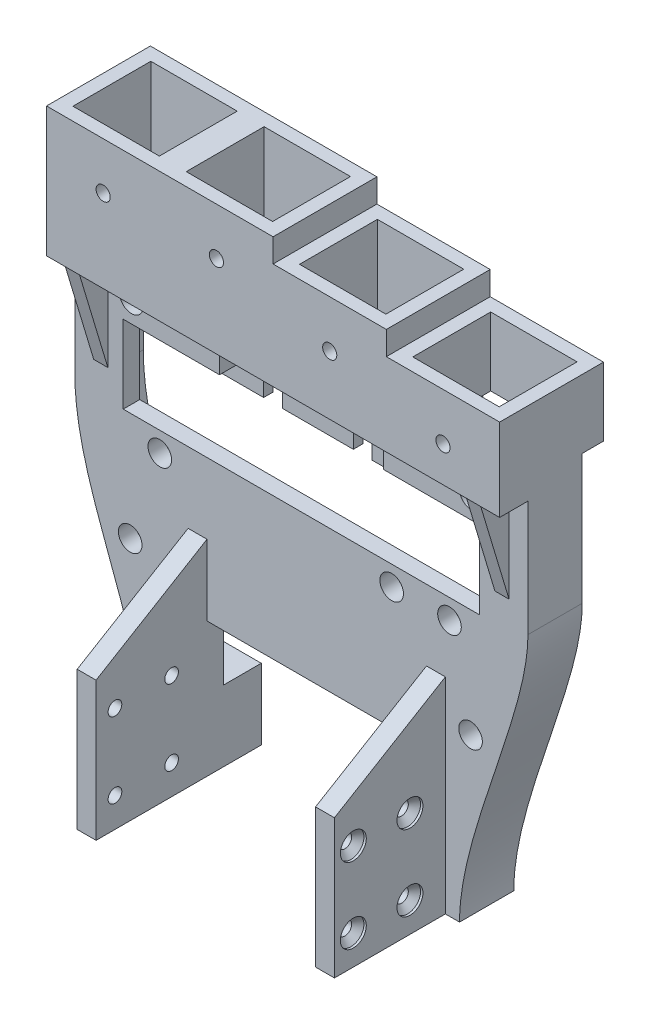
from build123d import *

# Parameters (mm, degrees)
BOSS_EXTRUDE1_DEPTH                            = 3.5
BOSS_EXTRUDE2_DEPTH                            = 6
BOSS_EXTRUDE3_DEPTH                            = 6
BOSS_EXTRUDE3_DEPTH_BACK                       = 16
SKETCH4_W                                      = 18.3
SKETCH4_H                                      = 16.5
CUT_EXTRUDE1_DEPTH                             = 24.5
SKETCH5_W                                      = 96
SKETCH5_H                                      = 3
BOSS_EXTRUDE4_DEPTH                            = 6
SKETCH6_W                                      = 75.5
SKETCH6_H                                      = 16.5
CUT_EXTRUDE2_DEPTH                             = 149.377895928
SKETCH7_W                                      = 10
SKETCH7_H                                      = 15.5
SKETCH7_W_2                                    = 20
BOSS_EXTRUDE5_DEPTH                            = 2
SKETCH9_R                                      = 1.25
CUT_EXTRUDE3_DEPTH                             = 149.377895928
BOSS_EXTRUDE7_START                            = -7
BOSS_EXTRUDE7_DEPTH                            = 3
BOSS_EXTRUDE8_START                            = -92
BOSS_EXTRUDE8_DEPTH                            = 3
SKETCH19_W                                     = 46.5
SKETCH19_H                                     = 28.5
CUT_EXTRUDE8_DEPTH                             = 149.041379351
SKETCH20_W                                     = 4
SKETCH20_H                                     = 28.5
BOSS_EXTRUDE10_DEPTH                           = 23.5
SKETCH21_R                                     = 1
CUT_EXTRUDE9_DEPTH                             = 140.410365468
CUT_EXTRUDE10_DEPTH                            = 150.372855633
CHAMFER2_SIZE                                  = 15
CHAMFER2_SIZE_2                                = 25
SKETCH23_W                                     = 10
SKETCH23_H                                     = 8.5
SKETCH23_W_2                                   = 20
BOSS_EXTRUDE11_DEPTH                           = 6
BOSS_EXTRUDE12_REACH                           = 151.963
BOSS_EXTRUDE13_DEPTH                           = 8
SKETCH28_R                                     = 2
CUT_EXTRUDE11_DEPTH                            = 5
SKETCH29_R                                     = 1.5
CUT_EXTRUDE12_DEPTH                            = 2.75
SKETCH31_W                                     = 76
SKETCH31_H                                     = 7
BOSS_EXTRUDE14_DEPTH                           = 2
SKETCH30_W                                     = 4
SKETCH30_H                                     = 7
CUT_EXTRUDE13_DEPTH                            = 2
SKETCH32_W                                     = 4
SKETCH32_H                                     = 8.5
BOSS_EXTRUDE15_DEPTH                           = 8
SKETCH33_R                                     = 1
CUT_EXTRUDE14_DEPTH                            = 152.608047343
CUT_EXTRUDE15_DEPTH                            = 8
FILLET1_START                                  = -8
FILLET1_DEPTH                                  = 8
SKETCH35_R                                     = 2.5
CUT_EXTRUDE16_DEPTH                            = 150.372855697
SKETCH36_W                                     = 34.7
SKETCH36_H                                     = 5.7
CUT_EXTRUDE17_DEPTH                            = 3.5
CSK_FOR_M2_5_COUNTERSUNK_FLAT_HEAD_S_2_COUNT   = 2
CSK_FOR_M2_5_COUNTERSUNK_FLAT_HEAD_S_2_PITCH   = 16
CSK_FOR_M2_5_COUNTERSUNK_FLAT_HEAD_S_3_COUNT   = 2
CSK_FOR_M2_5_COUNTERSUNK_FLAT_HEAD_S_3_PITCH   = 20
CSK_FOR_M2_5_COUNTERSUNK_FLAT_HEAD_S_4_COUNT   = 2
CSK_FOR_M2_5_COUNTERSUNK_FLAT_HEAD_S_4_PITCH   = 12
CSK_FOR_M2_5_COUNTERSUNK_FLAT_HEAD_S_5_A_COUNT = 2
CSK_FOR_M2_5_COUNTERSUNK_FLAT_HEAD_S_5_A_PITCH = 12
CSK_FOR_M2_5_COUNTERSUNK_FLAT_HEAD_S_6_COUNT   = 2
CSK_FOR_M2_5_COUNTERSUNK_FLAT_HEAD_S_6_PITCH   = 20
CSK_FOR_M2_5_COUNTERSUNK_FLAT_HEAD_S_7_COUNT   = 2
CSK_FOR_M2_5_COUNTERSUNK_FLAT_HEAD_S_7_PITCH   = 16


with BuildPart() as part:
    # Sketch1 → Boss-Extrude1 (new body)
    with BuildSketch(Plane.XY):
        Polygon((0, 0), (0, 112), (48, 112), (48, 107), (72, 107), (72, 102), (96, 102), (96, 0), align=None)
    extrude(amount=BOSS_EXTRUDE1_DEPTH)

    # Sketch3 → Boss-Extrude2 (add)
    with BuildSketch(Plane.XY.offset(3.5)):
        Polygon((0, 112), (48, 112), (48, 107), (72, 107), (72, 102), (96, 102), (96, 87.5), (0, 87.5), align=None)
    extrude(amount=BOSS_EXTRUDE2_DEPTH)

    # Sketch3<2> → Boss-Extrude3 (add, two sides: drawn at the far end of the back side and taken through both)
    with BuildSketch(Plane.XY.offset(3.5).offset(-BOSS_EXTRUDE3_DEPTH_BACK)):
        Polygon((0, 112), (48, 112), (48, 107), (72, 107), (72, 102), (96, 102), (96, 87.5), (0, 87.5), align=None)
    extrude(amount=BOSS_EXTRUDE3_DEPTH + BOSS_EXTRUDE3_DEPTH_BACK)

    # Sketch4 → Cut-Extrude1 (cut)
    with BuildSketch(Plane(origin=(0, 112, 0), x_dir=(1, 0, 0), z_dir=(0, 1, 0))):
        with Locations((12, 1.5)):
            Rectangle(SKETCH4_W, SKETCH4_H)
        with Locations((36, 1.5)):
            Rectangle(SKETCH4_W, SKETCH4_H)
        with Locations((60, 1.5)):
            Rectangle(SKETCH4_W, SKETCH4_H)
        with Locations((84, 1.5)):
            Rectangle(SKETCH4_W, SKETCH4_H)
    extrude(amount=-CUT_EXTRUDE1_DEPTH, mode=Mode.SUBTRACT)

    # Sketch5 → Boss-Extrude4 (add)
    with BuildSketch(Plane.XY.offset(3.5)):
        with Locations((48, 86)):
            Rectangle(SKETCH5_W, SKETCH5_H)
    extrude(amount=BOSS_EXTRUDE4_DEPTH)

    # Sketch6 → Cut-Extrude2 (cut, through all)
    with BuildSketch(Plane.XY.offset(3.5)):
        with Locations((48, 66.75)):
            Rectangle(SKETCH6_W, SKETCH6_H)
    extrude(amount=-CUT_EXTRUDE2_DEPTH, mode=Mode.SUBTRACT)

    # Sketch7 → Boss-Extrude5 (add)
    with BuildSketch(Plane(origin=(0, 0, 0), x_dir=(-1, 0, 0), z_dir=(0, 0, -1))):
        with Locations((-91, 79.75)):
            Rectangle(SKETCH7_W, SKETCH7_H)
        with Locations((-72, 79.75)):
            Rectangle(SKETCH7_W_2, SKETCH7_H)
        with Locations((-48, 79.75)):
            Rectangle(SKETCH7_W_2, SKETCH7_H)
        with Locations((-24, 79.75)):
            Rectangle(SKETCH7_W_2, SKETCH7_H)
        with Locations((-5, 79.75)):
            Rectangle(SKETCH7_W, SKETCH7_H)
    extrude(amount=BOSS_EXTRUDE5_DEPTH)

    # Sketch9 → Cut-Extrude3 (cut, through all)
    with BuildSketch(Plane.XY.offset(3.5)):
        with Locations((84, 79.4)):
            Circle(SKETCH9_R)
        with Locations((79.375, 54.3)):
            Circle(SKETCH9_R)
        with Locations((67.125, 54.3)):
            Circle(SKETCH9_R)
        with Locations((18, 54.3)):
            Circle(SKETCH9_R)
        with Locations((12, 79.4)):
            Circle(SKETCH9_R)
    extrude(amount=-CUT_EXTRUDE3_DEPTH, mode=Mode.SUBTRACT)

    # Sketch13 → Boss-Extrude7 (add)
    with BuildSketch(Plane(origin=(96, 0, 0), x_dir=(0, 0, -1), z_dir=(1, 0, 0)).offset(BOSS_EXTRUDE7_START)):
        Polygon((-3.5, 64.5), (-3.5, 84.5), (-9.5, 84.5), align=None)
    extrude(amount=BOSS_EXTRUDE7_DEPTH)

    # Sketch13<2> → Boss-Extrude8 (add)
    with BuildSketch(Plane(origin=(96, 0, 0), x_dir=(0, 0, -1), z_dir=(1, 0, 0)).offset(BOSS_EXTRUDE8_START)):
        Polygon((-3.5, 64.5), (-3.5, 84.5), (-9.5, 84.5), align=None)
    extrude(amount=BOSS_EXTRUDE8_DEPTH)

    # Sketch19 → Cut-Extrude8 (cut, through all)
    with BuildSketch(Plane(origin=(0, 0, 0), x_dir=(-1, 0, 0), z_dir=(0, 0, -1))):
        with Locations((-51.25, 14.25)):
            Rectangle(SKETCH19_W, SKETCH19_H)
    extrude(amount=-CUT_EXTRUDE8_DEPTH, mode=Mode.SUBTRACT)

    # Sketch20 → Boss-Extrude10 (add)
    with BuildSketch(Plane.XY.offset(3.5)):
        with Locations((76.5, 14.25)):
            Rectangle(SKETCH20_W, SKETCH20_H)
        with Locations((26, 14.25)):
            Rectangle(SKETCH20_W, SKETCH20_H)
    extrude(amount=BOSS_EXTRUDE10_DEPTH)

    # Sketch21 → Cut-Extrude9 (cut, through all)
    with BuildSketch(Plane(origin=(78.5, 0, 0), x_dir=(0, 0, -1), z_dir=(1, 0, 0))):
        with Locations(Location((-23, 6.25, 0), (0, 0, 90))):
            Circle(SKETCH21_R)
        with Locations(Location((-23, 22.25, 0), (0, 0, 90))):
            Circle(SKETCH21_R)
        with Locations(Location((-11, 22.25, 0), (0, 0, 90))):
            Circle(SKETCH21_R)
        with Locations(Location((-11, 6.25, 0), (0, 0, 90))):
            Circle(SKETCH21_R)
    extrude(amount=-CUT_EXTRUDE9_DEPTH, mode=Mode.SUBTRACT)

    # Sketch22 → Cut-Extrude10 (cut, through all)
    with BuildSketch(Plane.XY.offset(3.5)):
        with BuildLine():
            Line((0, 60), (0, 0))
            Line((0, 0), (14.5, 0))
            add(Edge.make_bspline(
                [(0, 60), (0, 38.91249655), (14.5, 21.1060871), (14.5, 0)],
                knots=[0, 0, 0, 0, 1, 1, 1, 1], degree=3))
        make_face()
        with BuildLine():
            Line((81.5, 0), (96, 0))
            Line((96, 0), (96, 60))
            add(Edge.make_bspline(
                [(96, 60), (96, 44.479329369), (81.5, 17.438131956), (81.5, 0)],
                knots=[0, 0, 0, 0, 1, 1, 1, 1], degree=3))
        make_face()
    extrude(amount=-CUT_EXTRUDE10_DEPTH, mode=Mode.SUBTRACT)

    # Chamfer2
    # the kernel refuses this chamfer: 25, 15 mm, written as the material it adds along each edge
    with BuildSketch(Plane(origin=(92.65652743, 28.5, 3.5), x_dir=(0, 1, 0), z_dir=(-1, 0, 0))) as chamfer2_piece_1_section:
        Polygon((CHAMFER2_SIZE, 0), (0, -CHAMFER2_SIZE_2), (0, 0), align=None)
    chamfer2_piece_1 = extrude(amount=133.31305486, mode=Mode.PRIVATE)
    chamfer2_piece_1 = split(chamfer2_piece_1, bisect_by=Plane(origin=(74.5, 28.5, 3.5), z_dir=(1, 0, 0)), keep=Keep.TOP, mode=Mode.PRIVATE)
    chamfer2_piece_1 = split(chamfer2_piece_1, bisect_by=Plane(origin=(78.5, 28.5, 3.5), z_dir=(-1, 0, 0)), keep=Keep.TOP, mode=Mode.PRIVATE)
    chamfer2_piece_1 = split(chamfer2_piece_1, bisect_by=Plane(origin=(92.65652743, 28.5, 27), z_dir=(0, 0, -1)), keep=Keep.TOP, mode=Mode.PRIVATE)
    add(chamfer2_piece_1)
    with BuildSketch(Plane(origin=(28, 28.5, 3.5), x_dir=(0, 1, 0), z_dir=(-1, 0, 0))) as chamfer2_piece_2_section:
        Polygon((CHAMFER2_SIZE, 0), (0, -CHAMFER2_SIZE_2), (0, 0), align=None)
    chamfer2_piece_2 = extrude(amount=4, mode=Mode.PRIVATE)
    chamfer2_piece_2 = split(chamfer2_piece_2, bisect_by=Plane(origin=(28, 28.5, 27), z_dir=(0, 0, -1)), keep=Keep.TOP, mode=Mode.PRIVATE)
    add(chamfer2_piece_2)
    with BuildSketch(Plane(origin=(9.84347257, 28.5, 3.5), x_dir=(0, 1, 0), z_dir=(1, 0, 0))) as chamfer2_piece_3_section:
        Polygon((CHAMFER2_SIZE, 0), (0, CHAMFER2_SIZE_2), (0, 0), align=None)
    chamfer2_piece_3 = extrude(amount=133.31305486, mode=Mode.PRIVATE)
    chamfer2_piece_3 = split(chamfer2_piece_3, bisect_by=Plane(origin=(28, 28.5, 3.5), z_dir=(-1, 0, 0)), keep=Keep.TOP, mode=Mode.PRIVATE)
    chamfer2_piece_3 = split(chamfer2_piece_3, bisect_by=Plane(origin=(24, 28.5, 3.5), z_dir=(1, 0, 0)), keep=Keep.TOP, mode=Mode.PRIVATE)
    chamfer2_piece_3 = split(chamfer2_piece_3, bisect_by=Plane(origin=(9.84347257, 28.5, 27), z_dir=(0, 0, -1)), keep=Keep.TOP, mode=Mode.PRIVATE)
    add(chamfer2_piece_3)
    with BuildSketch(Plane(origin=(74.5, 28.5, 3.5), x_dir=(0, 1, 0), z_dir=(1, 0, 0))) as chamfer2_piece_4_section:
        Polygon((CHAMFER2_SIZE, 0), (0, CHAMFER2_SIZE_2), (0, 0), align=None)
    chamfer2_piece_4 = extrude(amount=4, mode=Mode.PRIVATE)
    chamfer2_piece_4 = split(chamfer2_piece_4, bisect_by=Plane(origin=(74.5, 28.5, 27), z_dir=(0, 0, -1)), keep=Keep.TOP, mode=Mode.PRIVATE)
    add(chamfer2_piece_4)

    # Sketch23 → Boss-Extrude11 (add)
    with BuildSketch(Plane(origin=(0, 0, -2), x_dir=(-1, 0, 0), z_dir=(0, 0, -1))):
        with Locations((-91, 83.25)):
            Rectangle(SKETCH23_W, SKETCH23_H)
        with Locations((-72, 83.25)):
            Rectangle(SKETCH23_W_2, SKETCH23_H)
        with Locations((-48, 83.25)):
            Rectangle(SKETCH23_W_2, SKETCH23_H)
        with Locations((-24, 83.25)):
            Rectangle(SKETCH23_W_2, SKETCH23_H)
        with Locations((-5, 83.25)):
            Rectangle(SKETCH23_W, SKETCH23_H)
    extrude(amount=BOSS_EXTRUDE11_DEPTH)

    # Boss-Extrude12: up to this face of the body (flat: up to its plane)
    boss_extrude12_end = Plane(part.part.faces().sort_by_distance((91, 83.25, -8))[0])
    # Sketch25 → Boss-Extrude12 (add, up to the picked face)
    with BuildSketch(Plane(origin=(0, 0, 0), x_dir=(-1, 0, 0), z_dir=(0, 0, -1)), mode=Mode.PRIVATE) as boss_extrude12_sk1:
        with BuildLine():
            Line((-96, 72), (-96, 60))
            add(Edge.make_bspline(
                [(-96, 60), (-96, 44.479329369), (-81.5, 17.438131956), (-81.5, 0)],
                knots=[0, 0, 0, 0, 1, 1, 1, 1], degree=3))
            Line((-81.5, 0), (-78.5, 0))
            add(Edge.make_bspline(
                [(-93, 60), (-93, 59.557816417), (-92.975040614, 58.695571703), (-92.827111841, 56.79827861), (-92.464493125, 54.245611233), (-91.775146218, 50.906511623), (-90.567249245, 46.161807553), (-88.616785555, 39.780457105), (-85.908273471, 31.695495019), (-83.173013091, 23.441525704), (-81.155530615, 16.62102995), (-79.871757105, 11.305292179), (-79.119035762, 7.410326951), (-78.706235407, 4.261007874), (-78.530993655, 1.79992434), (-78.5, 0.602960826), (-78.5, 0)],
                knots=[0, 0, 0, 0, 0.03125, 0.0625, 0.125, 0.1875, 0.25, 0.375, 0.5, 0.625, 0.75, 0.8125, 0.875, 0.9375, 0.96875, 1, 1, 1, 1], degree=3))
            Line((-93, 60), (-93, 72))
            Line((-93, 72), (-93, 79))
            Line((-93, 79), (-96, 79))
            Line((-96, 79), (-96, 72))
        make_face()
    boss_extrude12_tool1 = split(extrude(boss_extrude12_sk1.sketch, amount=BOSS_EXTRUDE12_REACH, mode=Mode.PRIVATE), bisect_by=boss_extrude12_end, keep=Keep.BOTH, mode=Mode.PRIVATE)
    # Sketch25 → Boss-Extrude12 (add, up to the picked face)
    with BuildSketch(Plane(origin=(0, 0, 0), x_dir=(-1, 0, 0), z_dir=(0, 0, -1)), mode=Mode.PRIVATE) as boss_extrude12_sk2:
        with BuildLine():
            Line((0, 60), (0, 72))
            Line((0, 72), (0, 79))
            Line((0, 79), (-3, 79))
            Line((-3, 79), (-3, 72))
            Line((-3, 72), (-3, 60))
            add(Edge.make_bspline(
                [(-17.5, 0), (-17.5, 1.389708781), (-17.379306316, 4.18867325), (-16.720428739, 9.601539546), (-15.238805861, 16.15624072), (-12.795783031, 23.718268712), (-10.053136414, 31.075787181), (-7.358206107, 38.306889553), (-5.043365619, 45.489457561), (-3.423025008, 52.669495341), (-3, 57.557046138), (-3, 60)],
                knots=[0, 0, 0, 0, 0.0625, 0.125, 0.25, 0.375, 0.5, 0.625, 0.75, 0.875, 1, 1, 1, 1], degree=3))
            Line((-17.5, 0), (-14.5, 0))
            add(Edge.make_bspline(
                [(-14.5, 0), (-14.5, 21.1060871), (0, 38.91249655), (0, 60)],
                knots=[0, 0, 0, 0, 1, 1, 1, 1], degree=3))
        make_face()
    boss_extrude12_tool2 = split(extrude(boss_extrude12_sk2.sketch, amount=BOSS_EXTRUDE12_REACH, mode=Mode.PRIVATE), bisect_by=boss_extrude12_end, keep=Keep.BOTH, mode=Mode.PRIVATE)
    add(boss_extrude12_tool1.solids().sort_by(Axis((88.814086, 39.296604, 0), (0, 0, -1)))[0])
    add(boss_extrude12_tool2.solids().sort_by(Axis((0.809151, 66, 0), (0, 0, -1)))[0])

    # Sketch27 → Boss-Extrude13 (add)
    with BuildSketch(Plane(origin=(0, 0, 0), x_dir=(-1, 0, 0), z_dir=(0, 0, -1))):
        Polygon((-81.5, 0), (-74.5, 0), (-74.5, 15), (-80.78355962, 15), align=None)
        Polygon((-28, 0), (-14.5, 0), (-15.422624823, 15), (-28, 15), align=None)
    extrude(amount=BOSS_EXTRUDE13_DEPTH)

    # Sketch28 → Cut-Extrude11 (cut)
    with BuildSketch(Plane(origin=(0, 0, -8), x_dir=(-1, 0, 0), z_dir=(0, 0, -1))):
        with Locations((-91, 83.25)):
            Circle(SKETCH28_R)
        with Locations((-72, 83.25)):
            Circle(SKETCH28_R)
        with Locations((-48, 83.25)):
            Circle(SKETCH28_R)
        with Locations((-24, 83.25)):
            Circle(SKETCH28_R)
        with Locations((-5, 83.25)):
            Circle(SKETCH28_R)
        with Locations((-21.25, 7.5)):
            Circle(SKETCH28_R)
        with Locations((-78, 7.5)):
            Circle(SKETCH28_R)
    extrude(amount=-CUT_EXTRUDE11_DEPTH, mode=Mode.SUBTRACT)

    # Sketch29 → Cut-Extrude12 (cut)
    with BuildSketch(Plane.XY.offset(9.5)):
        with Locations((84, 92)):
            Circle(SKETCH29_R)
        with Locations((60, 97)):
            Circle(SKETCH29_R)
        with Locations((12, 102)):
            Circle(SKETCH29_R)
        with Locations((36, 102)):
            Circle(SKETCH29_R)
    extrude(amount=-CUT_EXTRUDE12_DEPTH, mode=Mode.SUBTRACT)

    # Sketch31 → Boss-Extrude14 (add)
    with BuildSketch(Plane(origin=(0, 0, -2), x_dir=(-1, 0, 0), z_dir=(0, 0, -1))):
        with Locations((-48, 75.5)):
            Rectangle(SKETCH31_W, SKETCH31_H)
    extrude(amount=-BOSS_EXTRUDE14_DEPTH)

    # Sketch30 → Cut-Extrude13 (cut)
    with BuildSketch(Plane(origin=(0, 0, -2), x_dir=(-1, 0, 0), z_dir=(0, 0, -1))):
        with Locations((-76.5, 75.5)):
            Rectangle(SKETCH30_W, SKETCH30_H)
        with Locations((-57.5, 75.5)):
            Rectangle(SKETCH30_W, SKETCH30_H)
        with Locations((-38.5, 75.5)):
            Rectangle(SKETCH30_W, SKETCH30_H)
        with Locations((-19.5, 75.5)):
            Rectangle(SKETCH30_W, SKETCH30_H)
    extrude(amount=-CUT_EXTRUDE13_DEPTH, mode=Mode.SUBTRACT)

    # Sketch32 → Boss-Extrude15 (add)
    with BuildSketch(Plane(origin=(0, 0, 0), x_dir=(-1, 0, 0), z_dir=(0, 0, -1))):
        with Locations((-84, 83.25)):
            Rectangle(SKETCH32_W, SKETCH32_H)
        with Locations((-60, 83.25)):
            Rectangle(SKETCH32_W, SKETCH32_H)
        with Locations((-36, 83.25)):
            Rectangle(SKETCH32_W, SKETCH32_H)
        with Locations((-12, 83.25)):
            Rectangle(SKETCH32_W, SKETCH32_H)
    extrude(amount=BOSS_EXTRUDE15_DEPTH)

    # Sketch33 → Cut-Extrude14 (cut, through all)
    with BuildSketch(Plane(origin=(0, 0, -8), x_dir=(-1, 0, 0), z_dir=(0, 0, -1))):
        with Locations((-78.5, 83)):
            Circle(SKETCH33_R)
        with Locations((-59.5, 83)):
            Circle(SKETCH33_R)
        with Locations((-36.5, 83)):
            Circle(SKETCH33_R)
        with Locations((-17.5, 83)):
            Circle(SKETCH33_R)
    extrude(amount=-CUT_EXTRUDE14_DEPTH, mode=Mode.SUBTRACT)

    # Sketch34 → Cut-Extrude15 (cut)
    with BuildSketch(Plane(origin=(0, 0, -8), x_dir=(-1, 0, 0), z_dir=(0, 0, -1))):
        with BuildLine():
            Line((-77.5, 79), (-75.5, 79))
            Line((-75.5, 79), (-75.5, 83))
            ThreePointArc((-75.5, 83), (-76.090385292, 84.787108547), (-77.629171307, 85.870828693))
            Line((-77.629171307, 85.870828693), (-83, 87.5))
            Line((-83, 87.5), (-85, 87.5))
            Line((-85, 87.5), (-78.039362063, 83.887588131))
            ThreePointArc((-78.039362063, 83.887588131), (-77.645412984, 83.519308224), (-77.5, 83))
            Line((-77.5, 83), (-77.5, 79))
        make_face()
        with BuildLine():
            Line((-58.5, 83), (-58.5, 79))
            Line((-58.5, 79), (-56.5, 79))
            Line((-56.5, 79), (-56.5, 83))
            ThreePointArc((-56.5, 83), (-56.527487495, 83.405178241), (-56.609446271, 83.802931591))
            Line((-56.609446271, 83.802931591), (-58.886409718, 92))
            Line((-58.886409718, 92), (-60.962136573, 92))
            Line((-60.962136573, 92), (-58.53648209, 83.267643864))
            ThreePointArc((-58.53648209, 83.267643864), (-58.509162498, 83.135059414), (-58.5, 83))
        make_face()
        with BuildLine():
            Line((-37.5, 83), (-37.5, 79))
            Line((-37.5, 79), (-39.5, 79))
            Line((-39.5, 79), (-39.5, 83))
            ThreePointArc((-39.5, 83), (-39.488297858, 83.264718549), (-39.453282727, 83.527371915))
            Line((-39.453282727, 83.527371915), (-37.047456283, 97))
            Line((-37.047456283, 97), (-35.015818761, 97))
            Line((-35.015818761, 97), (-37.484427576, 83.175790638))
            ThreePointArc((-37.484427576, 83.175790638), (-37.496099286, 83.088239516), (-37.5, 83))
        make_face()
        with BuildLine():
            Line((-18.5, 83), (-18.5, 79))
            Line((-18.5, 79), (-20.5, 79))
            Line((-20.5, 79), (-20.5, 83))
            ThreePointArc((-20.5, 83), (-20.409752544, 83.7303014), (-20.14443991, 84.416664238))
            Line((-20.14443991, 84.416664238), (-13.40336718, 97))
            Line((-13.40336718, 97), (-11.134455727, 97))
            Line((-11.134455727, 97), (-18.38147997, 83.472221413))
            ThreePointArc((-18.38147997, 83.472221413), (-18.469917515, 83.2434338), (-18.5, 83))
        make_face()
    extrude(amount=-CUT_EXTRUDE15_DEPTH, mode=Mode.SUBTRACT)

    # Fillet1: read off the stored shape, not the designer's step
    # Fillet1 outline → Fillet1 (cut)
    with BuildSketch(Plane.XY.offset(FILLET1_START)):
        with BuildLine():
            Line((83, 87.5), (74.85, 87.5))
            ThreePointArc((74.85, 87.5), (75.689930119, 85.76161962), (75.61776777, 83.832308461))
            ThreePointArc((75.61776777, 83.832308461), (76.364523998, 85.107069586), (77.629171307, 85.870828693))
            Line((77.629171307, 85.870828693), (83, 87.5))
        make_face()
        with BuildLine():
            Line((85.976140779, 87.5), (85, 87.5))
            Line((85, 87.5), (84.13358903, 87.050352525))
            ThreePointArc((84.13358903, 87.050352525), (85.027829148, 87.385962564), (85.976140779, 87.5))
        make_face()
        with BuildLine():
            Line((16.223741441, 87.5), (13.828775677, 87.5))
            ThreePointArc((13.828775677, 87.5), (15.883581921, 86.93187577), (17.354695557, 85.38888565))
            Line((17.354695557, 85.38888565), (16.223741441, 87.5))
        make_face()
        with BuildLine():
            Line((21.15, 87.5), (18.492652894, 87.5))
            Line((18.492652894, 87.5), (20.14443991, 84.416664238))
            ThreePointArc((20.14443991, 84.416664238), (20.27873967, 84.130754548), (20.38223223, 83.832308461))
            ThreePointArc((20.38223223, 83.832308461), (20.310069881, 85.76161962), (21.15, 87.5))
        make_face()
        with BuildLine():
            Line((57.636409718, 87.5), (52.517879978, 87.5))
            ThreePointArc((52.517879978, 87.5), (55.445580197, 86.225540575), (56.507662848, 83.214285714))
            ThreePointArc((56.507662848, 83.214285714), (56.543866161, 83.51114844), (56.609446271, 83.802931591))
            Line((56.609446271, 83.802931591), (57.636409718, 87.5))
        make_face()
        with BuildLine():
            ThreePointArc((39.453282727, 83.527371915), (39.476928732, 83.371342593), (39.492337152, 83.214285714))
            ThreePointArc((39.492337152, 83.214285714), (40.554419803, 86.225540575), (43.482120022, 87.5))
            Line((43.482120022, 87.5), (38.743884854, 87.5))
            Line((38.743884854, 87.5), (39.453282727, 83.527371915))
        make_face()
        with BuildLine():
            Line((37.300968305, 84.203162554), (36.712247332, 87.5))
            Line((36.712247332, 87.5), (33.363258003, 87.5))
            ThreePointArc((33.363258003, 87.5), (35.931073201, 86.566973281), (37.300968305, 84.203162554))
        make_face()
    extrude(amount=FILLET1_DEPTH, mode=Mode.SUBTRACT)

    # Sketch35 → Cut-Extrude16 (cut, through all)
    with BuildSketch(Plane.XY.offset(3.5)):
        with Locations((12, 79.4)):
            Circle(SKETCH35_R)
        with Locations((84, 79.4)):
            Circle(SKETCH35_R)
        with Locations((79.375, 54.3)):
            Circle(SKETCH35_R)
        with Locations((67.125, 54.3)):
            Circle(SKETCH35_R)
        with Locations((18, 54.3)):
            Circle(SKETCH35_R)
        with Locations((83.839330344, 35.5)):
            Circle(SKETCH35_R)
        with Locations((11.728705136, 35.5)):
            Circle(SKETCH35_R)
    extrude(amount=-CUT_EXTRUDE16_DEPTH, mode=Mode.SUBTRACT)

    # Sketch36 → Cut-Extrude17 (cut)
    with BuildSketch(Plane.XY.offset(3.5)):
        with Locations((48, 77.85)):
            Rectangle(SKETCH36_W, SKETCH36_H)
    extrude(amount=-CUT_EXTRUDE17_DEPTH, mode=Mode.SUBTRACT)

    # Sketch39 → CSK for M2.5 Countersunk Flat Head Screw (revolve, cut)
    with BuildSketch(Plane(origin=(78.5, 6.25, 11), x_dir=(0, 0, -1), z_dir=(0, 1, 0))):
        Polygon((0, 0), (0, 78.5), (1.45, 78.5), (1.45, 1.8), (2.75, 0.5), (2.75, 0), align=None)
    csk_for_m2_5_countersunk_flat_head_screw = revolve(axis=Axis((84.85, 6.25, 11), (-1, 0, 0)), mode=Mode.SUBTRACT)

    # CSK for M2.5 Countersunk Flat Head S 2: CSK for M2.5 Countersunk Flat Head Screw ×2
    with Locations(*[(0, i * CSK_FOR_M2_5_COUNTERSUNK_FLAT_HEAD_S_2_PITCH, 0) for i in range(1, CSK_FOR_M2_5_COUNTERSUNK_FLAT_HEAD_S_2_COUNT)]):
        add(csk_for_m2_5_countersunk_flat_head_screw, mode=Mode.SUBTRACT)

    # CSK for M2.5 Countersunk Flat Head S 3: CSK for M2.5 Countersunk Flat Head Screw ×2
    with Locations(*[Vector(0, 0.8, 0.6000000000000001) * (i * CSK_FOR_M2_5_COUNTERSUNK_FLAT_HEAD_S_3_PITCH) for i in range(1, CSK_FOR_M2_5_COUNTERSUNK_FLAT_HEAD_S_3_COUNT)]):
        add(csk_for_m2_5_countersunk_flat_head_screw, mode=Mode.SUBTRACT)

    # CSK for M2.5 Countersunk Flat Head S 4: CSK for M2.5 Countersunk Flat Head Screw ×2
    with Locations(*[(0, 0, i * CSK_FOR_M2_5_COUNTERSUNK_FLAT_HEAD_S_4_PITCH) for i in range(1, CSK_FOR_M2_5_COUNTERSUNK_FLAT_HEAD_S_4_COUNT)]):
        add(csk_for_m2_5_countersunk_flat_head_screw, mode=Mode.SUBTRACT)

    # Sketch41 → CSK for M2.5 Countersunk Flat Head S 5 (revolve, cut)
    with BuildSketch(Plane(origin=(24, 6.25, 23), x_dir=(0, 0, 1), z_dir=(0, 1, 0))):
        Polygon((0, 0), (0, 72), (1.45, 72), (1.45, 1.8), (2.75, 0.5), (2.75, 0), align=None)
    csk_for_m2_5_countersunk_flat_head_s_5 = revolve(axis=Axis((17.65, 6.25, 23), (1, 0, 0)), mode=Mode.SUBTRACT)

    # CSK for M2.5 Countersunk Flat Head S 5 a: CSK for M2.5 Countersunk Flat Head S 5 ×2
    with Locations(*[(0, 0, -i * CSK_FOR_M2_5_COUNTERSUNK_FLAT_HEAD_S_5_A_PITCH) for i in range(1, CSK_FOR_M2_5_COUNTERSUNK_FLAT_HEAD_S_5_A_COUNT)]):
        add(csk_for_m2_5_countersunk_flat_head_s_5, mode=Mode.SUBTRACT)

    # CSK for M2.5 Countersunk Flat Head S 6: CSK for M2.5 Countersunk Flat Head S 5 ×2
    with Locations(*[Vector(0, 0.8, -0.6) * (i * CSK_FOR_M2_5_COUNTERSUNK_FLAT_HEAD_S_6_PITCH) for i in range(1, CSK_FOR_M2_5_COUNTERSUNK_FLAT_HEAD_S_6_COUNT)]):
        add(csk_for_m2_5_countersunk_flat_head_s_5, mode=Mode.SUBTRACT)

    # CSK for M2.5 Countersunk Flat Head S 7: CSK for M2.5 Countersunk Flat Head S 5 ×2
    with Locations(*[(0, i * CSK_FOR_M2_5_COUNTERSUNK_FLAT_HEAD_S_7_PITCH, 0) for i in range(1, CSK_FOR_M2_5_COUNTERSUNK_FLAT_HEAD_S_7_COUNT)]):
        add(csk_for_m2_5_countersunk_flat_head_s_5, mode=Mode.SUBTRACT)


solid = part.part
